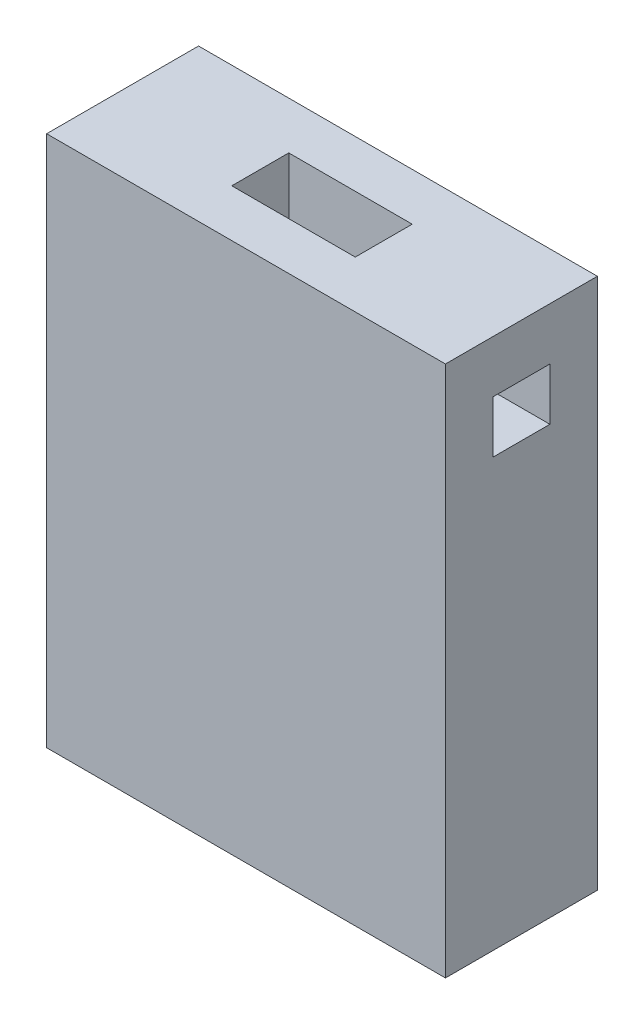
from build123d import *

# Parameters (mm, degrees)
ESQUISSE1_W             = 42
ESQUISSE1_H             = 16
BOSS_EXTRU_1_DEPTH      = 56
ESQUISSE2_W             = 13
ESQUISSE2_H             = 6
ENL_V_MAT_EXTRU_1_DEPTH = 11
ESQUISSE3_W             = 6
ESQUISSE3_H             = 5.5
ENL_V_MAT_EXTRU_2_DEPTH = 63.898728127


with BuildPart() as part:
    # Esquisse1 → Boss.-Extru.1 (new body)
    with BuildSketch(Plane(origin=(0, 0, 0), x_dir=(1, 0, 0), z_dir=(0, 1, 0))):
        Rectangle(ESQUISSE1_W, ESQUISSE1_H)
    extrude(amount=BOSS_EXTRU_1_DEPTH)

    # Esquisse2 → Enlèv. mat.-Extru.1 (cut)
    with BuildSketch(Plane(origin=(0, 56, 0), x_dir=(1, 0, 0), z_dir=(0, 1, 0))):
        Rectangle(ESQUISSE2_W, ESQUISSE2_H)
    extrude(amount=-ENL_V_MAT_EXTRU_1_DEPTH, mode=Mode.SUBTRACT)

    # Esquisse3 → Enlèv. mat.-Extru.2 (cut, through all)
    with BuildSketch(Plane(origin=(-6.5, 0, 0), x_dir=(0, 0, -1), z_dir=(1, 0, 0))):
        with Locations((0, 47.75)):
            Rectangle(ESQUISSE3_W, ESQUISSE3_H)
    extrude(amount=ENL_V_MAT_EXTRU_2_DEPTH, mode=Mode.SUBTRACT)


solid = part.part
